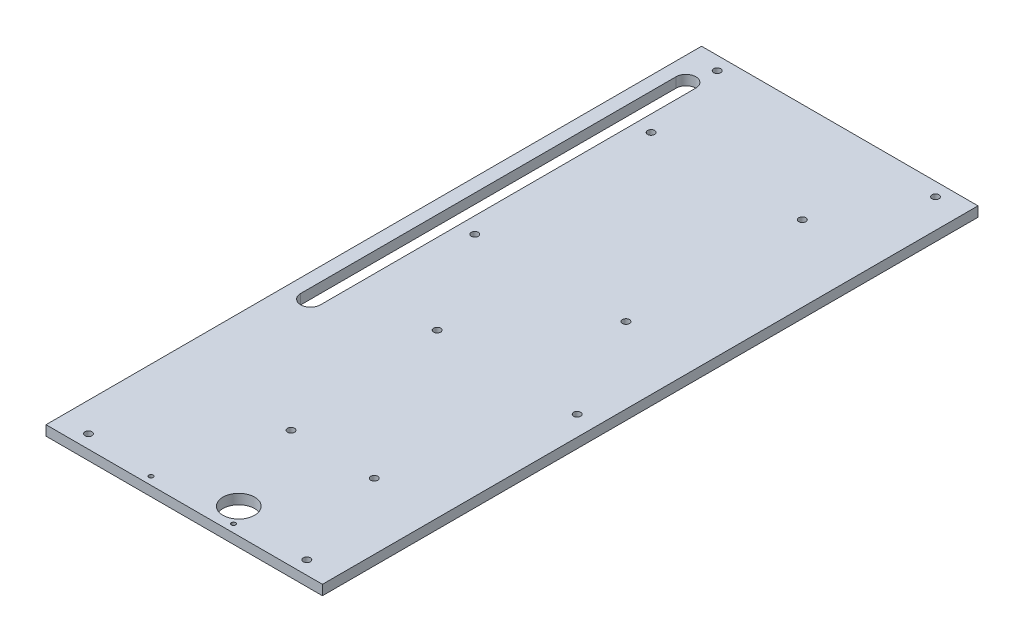
from build123d import *

# Parameters (mm, degrees)
SKETCH2_W           = 88.9
SKETCH2_H           = 3.2004
BOSS_EXTRUDE1_DEPTH = 210.82
SKETCH3_R           = 0.6731
SKETCH3_R_2         = 5.08
SKETCH3_R_3         = 1.1303
CUT_EXTRUDE1_DEPTH  = 216.82004684


with BuildPart() as part:
    # Sketch2 → Boss-Extrude1 (new body)
    with BuildSketch(Plane.XY):
        with Locations((-1.625781684, -22.993244248)):
            Rectangle(SKETCH2_W, SKETCH2_H)
    extrude(amount=BOSS_EXTRUDE1_DEPTH)

    # Sketch3 → Cut-Extrude1 (cut, through all)
    with BuildSketch(Plane(origin=(0, -21.393044248, 0), x_dir=(-1, 0, 0), z_dir=(0, 1, 0))):
        with Locations((14.833781684, 208.28)):
            Circle(SKETCH3_R)
        with Locations((-11.683818316, 208.28)):
            Circle(SKETCH3_R)
        with Locations((-7.619818316, 202.518755316)):
            Circle(SKETCH3_R_2)
        with Locations((-33.478453416, 206.502)):
            Circle(SKETCH3_R_3)
        with Locations((36.730016784, 206.502)):
            Circle(SKETCH3_R_3)
        with Locations((-33.478453416, 4.318)):
            Circle(SKETCH3_R_3)
        with Locations((36.730016784, 4.318)):
            Circle(SKETCH3_R_3)
        with Locations((-18.450986138, 32.12110162)):
            Circle(SKETCH3_R_3)
        with Locations((-18.450986138, 88.83930162)):
            Circle(SKETCH3_R_3)
        with Locations((30.164613862, 88.83930162)):
            Circle(SKETCH3_R_3)
        with Locations((30.164613862, 32.12110162)):
            Circle(SKETCH3_R_3)
        with Locations((-21.61210834, 172.955592112)):
            Circle(SKETCH3_R_3)
        with Locations((-36.421379204, 122.504632562)):
            Circle(SKETCH3_R_3)
        with Locations((5.12700506, 172.955592112)):
            Circle(SKETCH3_R_3)
        with Locations((9.515898481, 121.588311164)):
            Circle(SKETCH3_R_3)
        with Locations((81.579081393, -113.266782514)):
            Circle(SKETCH3_R_3)
        with Locations((66.769810529, -163.717742064)):
            Circle(SKETCH3_R_3)
        with Locations((108.318194793, -113.266782514)):
            Circle(SKETCH3_R_3)
        with Locations((97.604440284, -108.476314785)):
            Circle(SKETCH3_R_3)
        with Locations((82.79516942, -158.927274335)):
            Circle(SKETCH3_R_3)
        with Locations((124.343553684, -108.476314785)):
            Circle(SKETCH3_R_3)
        with Locations((112.789811005, -158.927274335)):
            Circle(SKETCH3_R_3)
        with BuildLine():
            Line((35.32929924, 12.595958552), (35.32929924, 133.302587666))
            ThreePointArc((35.32929924, 133.302587666), (38.50429924, 136.477587666), (41.67929924, 133.302587666))
            Line((41.67929924, 133.302587666), (41.67929924, 12.595958552))
            ThreePointArc((41.67929924, 12.595958552), (38.50429924, 9.420958552), (35.32929924, 12.595958552))
        make_face()
    extrude(amount=-CUT_EXTRUDE1_DEPTH, mode=Mode.SUBTRACT)


solid = part.part
